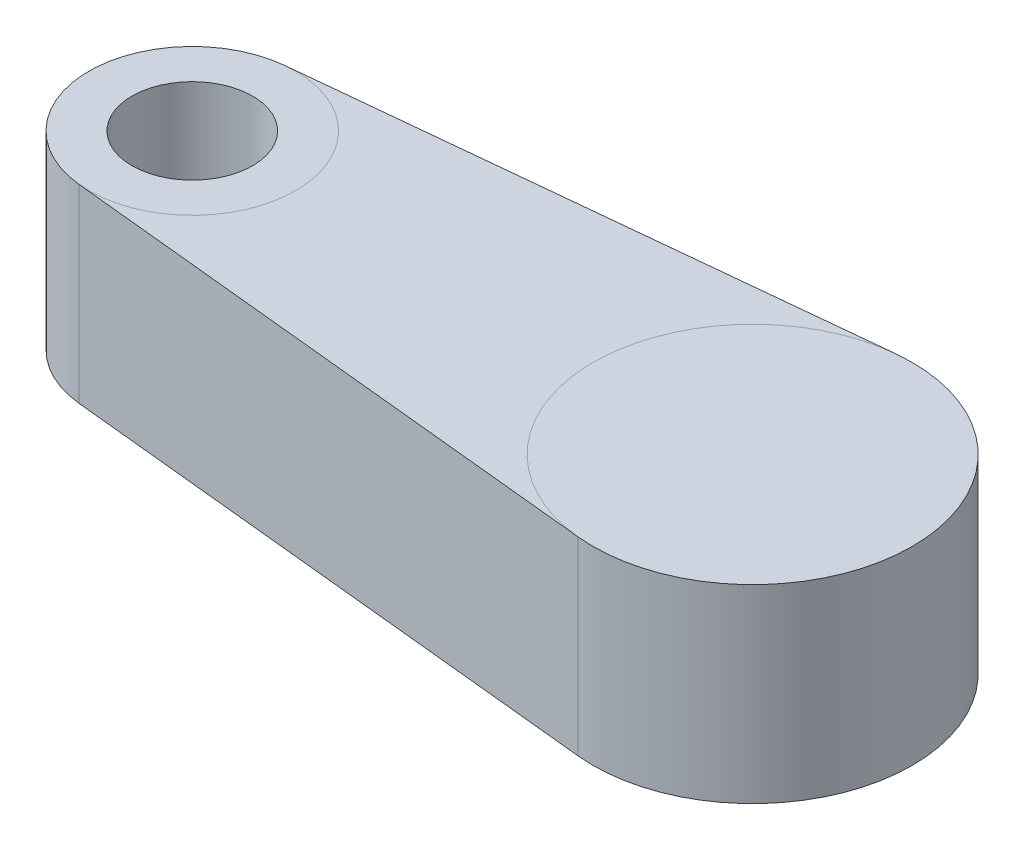
from build123d import *

# Parameters (mm, degrees)
BOSS_EXTRUDE1_DEPTH = 34.925
SKETCH2_6_R         = 11.1125
CUT_EXTRUDE2_DEPTH  = 34.925


with BuildPart() as part:
    # Sketch2 → Boss-Extrude1 (new body)
    with BuildSketch(Plane(origin=(0, 0, 0), x_dir=(1, 0, 0), z_dir=(0, 1, 0))):
        with BuildLine():
            Line((100.250625, 29.221537294), (-1.905, 18.954510677))
            ThreePointArc((-1.905, 18.954510677), (-19.05, 0), (-1.905, -18.954510677))
            Line((-1.905, -18.954510677), (100.250625, -29.221537294))
            ThreePointArc((100.250625, -29.221537294), (132.55625, 0), (100.250625, 29.221537294))
        make_face()
    extrude(amount=BOSS_EXTRUDE1_DEPTH)

    # Sketch2<6> → Cut-Extrude2 (cut)
    with BuildSketch(Plane(origin=(0, 0, 0), x_dir=(1, 0, 0), z_dir=(0, 1, 0))):
        Circle(SKETCH2_6_R)
    extrude(amount=CUT_EXTRUDE2_DEPTH, mode=Mode.SUBTRACT)


solid = part.part
